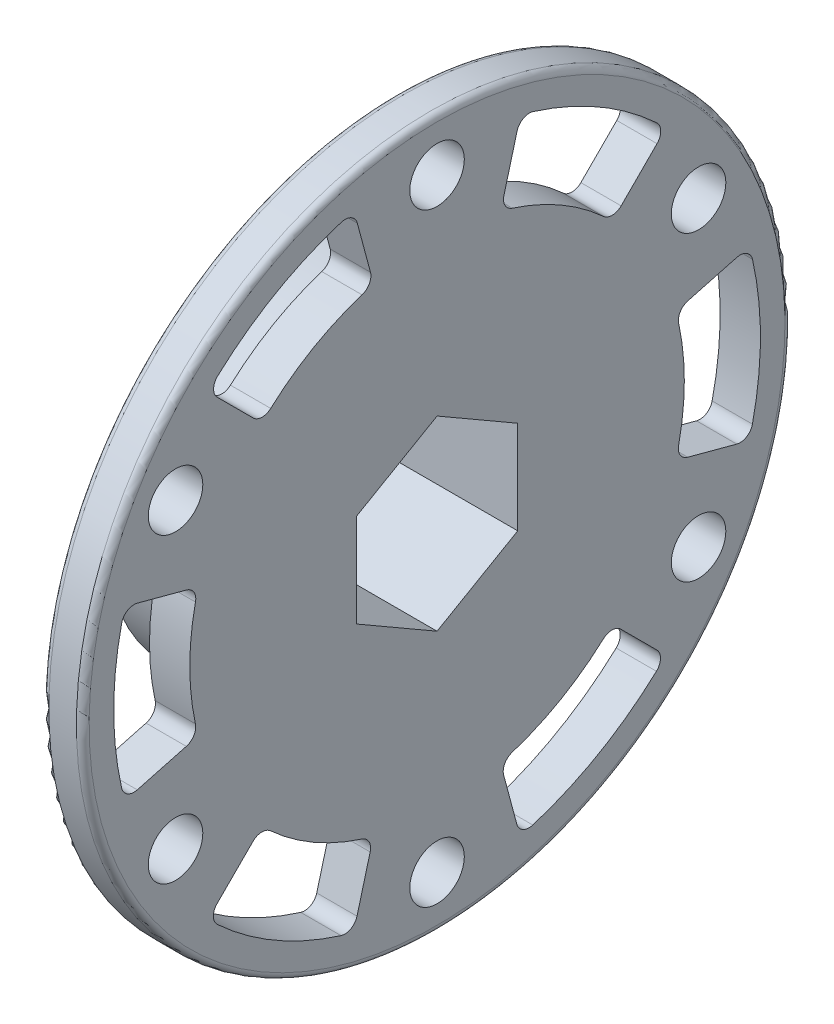
from build123d import *

# Parameters (mm, degrees)
SKETCH1_W                 = 3.175
SKETCH1_H                 = 27.94
CUT_EXTRUDE1_DEPTH        = 40.640482149
CUT_EXTRUDE2_DEPTH        = 40.640482149
CUT_EXTRUDE3_DEPTH        = 40.640482149
CUT_EXTRUDE4_DEPTH        = 40.640482149
CUT_EXTRUDE5_DEPTH        = 40.640482149
CUT_EXTRUDE6_DEPTH        = 40.640482149
SKETCH8_R                 = 14.294919975
BOSS_EXTRUDE1_DEPTH       = 9.525
CUT_EXTRUDE7_DEPTH        = 42.503941981
F_6_CLEARANCE_HOLE1_D     = 4.3
F_6_CLEARANCE_HOLE1_DEPTH = 12.7
CHAMFER1_SIZE             = 1
FILLET1_R                 = 0.5
FILLET2_R                 = 1
FILLET3_R                 = 1.27


with BuildPart() as part:
    # Sketch1 → Revolve1 (revolve)
    with BuildSketch(Plane(origin=(0, 0, 0), x_dir=(-1, 0, 0), z_dir=(0, 0, -1))):
        with Locations((-11.1125, 13.97)):
            Rectangle(SKETCH1_W, SKETCH1_H)
    revolve(axis=Axis((12.7, 0, 0), (-1, 0, 0)))

    # Sketch2 → Cut-Extrude1 (cut, through all)
    with BuildSketch(Plane.ZY.offset(-9.525)):
        with BuildLine():
            Line((-13.806531048, -13.770610024), (-18.049174487, -18.013253463))
            ThreePointArc((-18.049174487, -18.013253463), (-12.738999884, -22.089995065), (-6.550803522, -24.644207701))
            Line((-6.550803522, -24.644207701), (-4.997885221, -18.848637704))
            ThreePointArc((-4.997885221, -18.848637704), (-9.738999389, -16.893841804), (-13.806531048, -13.770610024))
        make_face()
    extrude(amount=-CUT_EXTRUDE1_DEPTH, mode=Mode.SUBTRACT)

    # Sketch3 → Cut-Extrude2 (cut, through all)
    with BuildSketch(Plane.ZY.offset(-9.525)):
        with BuildLine():
            Line((5.022432582, -18.842111637), (6.57534786, -24.637670355))
            ThreePointArc((6.57534786, -24.637670355), (12.760996954, -22.077295051), (18.067108165, -17.995266116))
            Line((18.067108165, -17.995266116), (13.824456468, -13.752614419))
            ThreePointArc((13.824456468, -13.752614419), (9.760996476, -16.88114178), (5.022432582, -18.842111637))
        make_face()
    extrude(amount=-CUT_EXTRUDE2_DEPTH, mode=Mode.SUBTRACT)

    # Sketch4 → Cut-Extrude3 (cut, through all)
    with BuildSketch(Plane.ZY.offset(-9.525)):
        with BuildLine():
            Line((18.82896363, -5.071501614), (24.624522347, -6.624416892))
            ThreePointArc((24.624522347, -6.624416892), (25.499996837, 0.012700014), (24.617911686, 6.648941586))
            Line((24.617911686, 6.648941586), (18.822341689, 5.096023285))
            ThreePointArc((18.822341689, 5.096023285), (19.499995864, 0.012700024), (18.82896363, -5.071501614))
        make_face()
    extrude(amount=-CUT_EXTRUDE3_DEPTH, mode=Mode.SUBTRACT)

    # Sketch5 → Cut-Extrude4 (cut, through all)
    with BuildSketch(Plane.ZY.offset(-9.525)):
        with BuildLine():
            Line((13.806531048, 13.770610024), (18.049174487, 18.013253463))
            ThreePointArc((18.049174487, 18.013253463), (12.738999884, 22.089995065), (6.550803522, 24.644207701))
            Line((6.550803522, 24.644207701), (4.997885221, 18.848637704))
            ThreePointArc((4.997885221, 18.848637704), (9.738999389, 16.893841804), (13.806531048, 13.770610024))
        make_face()
    extrude(amount=-CUT_EXTRUDE4_DEPTH, mode=Mode.SUBTRACT)

    # Sketch6 → Cut-Extrude5 (cut, through all)
    with BuildSketch(Plane.ZY.offset(-9.525)):
        with BuildLine():
            Line((-24.617911686, -6.648941586), (-18.822341689, -5.096023285))
            ThreePointArc((-18.822341689, -5.096023285), (-19.499995864, -0.012700024), (-18.82896363, 5.071501614))
            Line((-18.82896363, 5.071501614), (-24.624522347, 6.624416892))
            ThreePointArc((-24.624522347, 6.624416892), (-25.499996837, -0.012700014), (-24.617911686, -6.648941586))
        make_face()
    extrude(amount=-CUT_EXTRUDE5_DEPTH, mode=Mode.SUBTRACT)

    # Sketch7 → Cut-Extrude6 (cut, through all)
    with BuildSketch(Plane(origin=(12.7, 0, 0), x_dir=(0, 0, -1), z_dir=(1, 0, 0))):
        with BuildLine():
            Line((6.57534786, 24.637670355), (5.022432582, 18.842111637))
            ThreePointArc((5.022432582, 18.842111637), (9.760996476, 16.88114178), (13.824456468, 13.752614419))
            Line((13.824456468, 13.752614419), (18.067108165, 17.995266116))
            ThreePointArc((18.067108165, 17.995266116), (12.760996954, 22.077295051), (6.57534786, 24.637670355))
        make_face()
    extrude(amount=-CUT_EXTRUDE6_DEPTH, mode=Mode.SUBTRACT)

    # Sketch8 → Boss-Extrude1 (add)
    with BuildSketch(Plane.ZY.offset(-9.525)):
        Circle(SKETCH8_R)
    extrude(amount=BOSS_EXTRUDE1_DEPTH)

    # Sketch9 → Cut-Extrude7 (cut, through all)
    with BuildSketch(Plane(origin=(12.7, 0, 0), x_dir=(0, 0, -1), z_dir=(1, 0, 0))):
        Polygon((-6.3627, 3.673506558), (-6.3627, -3.673506558), (0, -7.347013116), (6.3627, -3.673506558), (6.3627, 3.673506558), (0, 7.347013116), align=None)
    extrude(amount=-CUT_EXTRUDE7_DEPTH, mode=Mode.SUBTRACT)

    # #6 Clearance Hole1
    with Locations(Plane(origin=(12.7, 0, 0), x_dir=(0, 0, -1), z_dir=(1, 0, 0))):
        with Locations((20.622229928, 11.90625), (20.622229928, -11.90625), (0, -23.8125), (-20.622229928, -11.90625), (-20.622229928, 11.90625), (0, 23.8125)):
            Hole(F_6_CLEARANCE_HOLE1_D / 2, depth=F_6_CLEARANCE_HOLE1_DEPTH)

    # Chamfer1
    chamfer1_edges = [part.edges().sort_by_distance(p)[0] for p in [
        (0, 0, -14.294919975),
    ]]
    chamfer(chamfer1_edges, length=CHAMFER1_SIZE)

    # Fillet1
    fillet1_edges = [part.edges().sort_by_distance(p)[0] for p in [
        (12.7, -27.94, 0),
        (9.525, -27.94, 0),
    ]]
    fillet(fillet1_edges, radius=FILLET1_R)

    # Fillet2
    fillet2_edges = [part.edges().sort_by_distance(p)[0] for p in [
        (11.1125, 6.648941586, 24.617911686),
        (11.1125, -17.995266116, 18.067108165),
        (11.1125, 24.644207701, 6.550803522),
        (11.1125, -18.842111637, 5.022432582),
        (11.1125, 18.842111637, -5.022432582),
        (11.1125, -5.071501614, 18.82896363),
        (11.1125, 24.637670355, -6.57534786),
        (11.1125, 13.770610024, 13.806531048),
        (11.1125, 17.995266116, -18.067108165),
        (11.1125, -18.848637704, -4.997885221),
        (11.1125, 13.752614419, -13.824456468),
        (11.1125, -24.637670355, 6.57534786),
        (11.1125, 5.071501614, -18.82896363),
        (11.1125, -13.752614419, 13.824456468),
        (11.1125, 6.624416892, -24.624522347),
        (11.1125, -6.624416892, 24.624522347),
        (11.1125, -6.648941586, -24.617911686),
        (11.1125, 5.096023285, 18.822341689),
        (11.1125, -5.096023285, -18.822341689),
        (11.1125, 18.013253463, 18.049174487),
        (11.1125, -13.770610024, -13.806531048),
        (11.1125, 18.848637704, 4.997885221),
        (11.1125, -18.013253463, -18.049174487),
        (11.1125, -24.644207701, -6.550803522),
    ]]
    fillet(fillet2_edges, radius=FILLET2_R)

    # Fillet3
    fillet3_edges = [part.edges().sort_by_distance(p)[0] for p in [
        (9.525, 0, -14.294919975),
    ]]
    fillet(fillet3_edges, radius=FILLET3_R)


solid = part.part
